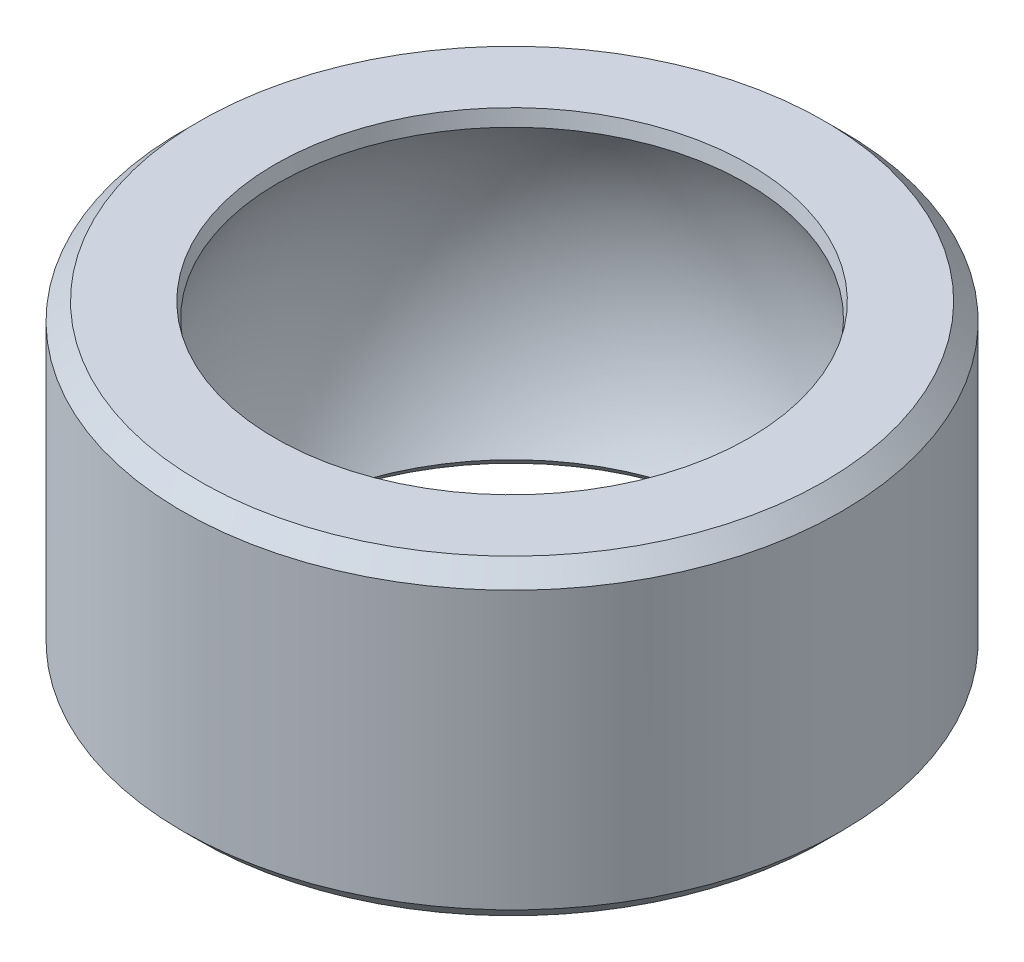
from build123d import *

# Parameters (mm, degrees)
CHAMFER1_SIZE   = 0.359317173
CHAMFER1_SIZE_2 = 0.5


with BuildPart() as part:
    # Sketch2 → Revolve1 (revolve)
    with BuildSketch(Plane.XY):
        with BuildLine():
            Line((-9.525, -4.5), (-9.525, 4.5))
            Line((-9.525, 4.5), (-6.493073232, 4.5))
            ThreePointArc((-6.493073232, 4.5), (-7.9, 0), (-6.493073232, -4.5))
            Line((-6.493073232, -4.5), (-9.525, -4.5))
        make_face()
    revolve(axis=Axis((0, -4.5, 0), (0, 1, 0)))

    # Chamfer1
    # the kernel refuses this chamfer: 0.5, 0.359317173 mm, written as the material it takes off along each edge
    with BuildSketch(Plane(origin=(0, 4.5, 0), x_dir=(-1, 0, 0), z_dir=(0, 0, -1))) as chamfer1_piece_1:
        with BuildLine():
            Line((6.493073232 + CHAMFER1_SIZE, 0), (6.773611969, -0.434513449))
            ThreePointArc((6.773611969, -0.434513449), (6.640861095, -0.221102487), (6.493073232, 0))
            Line((6.493073232, 0), (6.493073232 + CHAMFER1_SIZE, 0))
        make_face()
    revolve(axis=Axis((0, 4.5, 0), (0, 1, 0)), mode=Mode.SUBTRACT)
    with BuildSketch(Plane(origin=(0, 4.5, 0), x_dir=(-1, 0, 0), z_dir=(0, 0, -1))) as chamfer1_piece_2:
        Polygon((9.525, -CHAMFER1_SIZE_2), (9.525 - CHAMFER1_SIZE_2, 0), (9.525, 0), align=None)
    revolve(axis=Axis((0, 4.5, 0), (0, 1, 0)), mode=Mode.SUBTRACT)
    with BuildSketch(Plane(origin=(0, -4.5, 0), x_dir=(-1, 0, 0), z_dir=(0, 0, -1))) as chamfer1_piece_3:
        Polygon((9.525 - CHAMFER1_SIZE_2, 0), (9.525, CHAMFER1_SIZE_2), (9.525, 0), align=None)
    revolve(axis=Axis((0, -4.5, 0), (0, 1, 0)), mode=Mode.SUBTRACT)
    with BuildSketch(Plane(origin=(0, -4.5, 0), x_dir=(-1, 0, 0), z_dir=(0, 0, -1))) as chamfer1_piece_4:
        with BuildLine():
            Line((6.493073232 + CHAMFER1_SIZE_2, 0), (6.691823244, 0.301249988))
            ThreePointArc((6.691823244, 0.301249988), (6.595276141, 0.151168821), (6.493073232, 0))
            Line((6.493073232, 0), (6.493073232 + CHAMFER1_SIZE_2, 0))
        make_face()
    revolve(axis=Axis((0, -4.5, 0), (0, 1, 0)), mode=Mode.SUBTRACT)


solid = part.part
